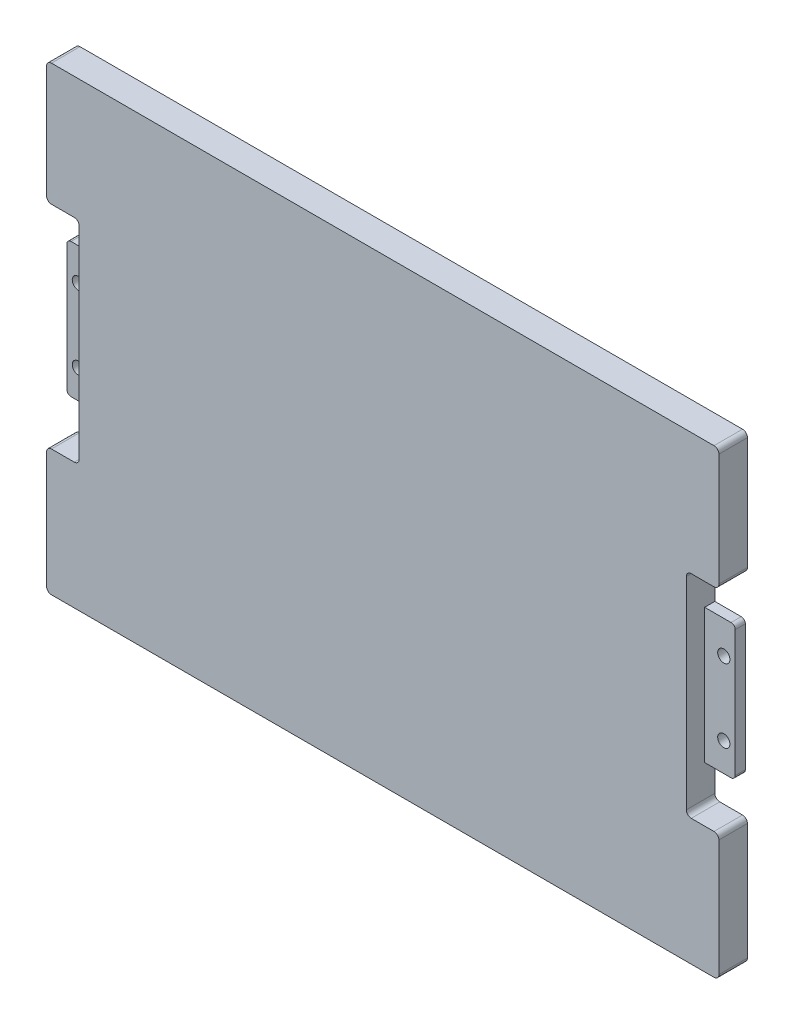
from build123d import *

# Parameters (mm, degrees)
EXTRUDE_1_DEPTH     = 7
SKETCH_2_R          = 6
CUT_EXTRUDE_1_DEPTH = 5.8
CUT_EXTRUDE_2_DEPTH = 0.2
FILLET_1_R          = 1
SKETCH_4_R          = 1.5
EXTRUDE_3_DEPTH     = 2.5
SKETCH_5_W          = 1.5
SKETCH_5_H          = 4.3
CUT_EXTRUDE_3_DEPTH = 2.5
SKETCH_6_W          = 3.174285876
SKETCH_6_H          = 3
CUT_EXTRUDE_4_DEPTH = 1


with BuildPart() as part:
    # Эскиз1 → Бобышка-Вытянуть1 (new body)
    with BuildSketch(Plane.XY):
        with BuildLine():
            Line((1.201755047, 83), (6.798244953, 83))
            ThreePointArc((6.798244953, 83), (7.648014096, 82.648014096), (8, 81.798244953))
            Line((8, 81.798244953), (8, 32.201755047))
            ThreePointArc((8, 32.201755047), (7.648014096, 31.351985904), (6.798244953, 31))
            Line((6.798244953, 31), (1.201755047, 31))
            ThreePointArc((1.201755047, 31), (0.351985904, 30.648014096), (0, 29.798244953))
            Line((0, 29.798244953), (0, 1.201755047))
            ThreePointArc((0, 1.201755047), (0.351985904, 0.351985904), (1.201755047, 0))
            Line((1.201755047, 0), (163.798244953, 0))
            ThreePointArc((163.798244953, 0), (164.648014096, 0.351985904), (165, 1.201755047))
            Line((165, 1.201755047), (165, 29.798244953))
            ThreePointArc((165, 29.798244953), (164.648014096, 30.648014096), (163.798244953, 31))
            Line((163.798244953, 31), (158.201755047, 31))
            ThreePointArc((158.201755047, 31), (157.351985904, 31.351985904), (157, 32.201755047))
            Line((157, 32.201755047), (157, 81.798244953))
            ThreePointArc((157, 81.798244953), (157.351985904, 82.648014096), (158.201755047, 83))
            Line((158.201755047, 83), (163.798244953, 83))
            ThreePointArc((163.798244953, 83), (164.648014096, 83.351985904), (165, 84.201755047))
            Line((165, 84.201755047), (165, 111.798244953))
            ThreePointArc((165, 111.798244953), (164.648014096, 112.648014096), (163.798244953, 113))
            Line((163.798244953, 113), (1.201755047, 113))
            ThreePointArc((1.201755047, 113), (0.351985904, 112.648014096), (0, 111.798244953))
            Line((0, 111.798244953), (0, 84.201755047))
            ThreePointArc((0, 84.201755047), (0.351985904, 83.351985904), (1.201755047, 83))
        make_face()
    extrude(amount=EXTRUDE_1_DEPTH)

    # Эскиз2 → Вырез-Вытянуть1 (cut)
    with BuildSketch(Plane(origin=(0, 0, 0), x_dir=(-1, 0, 0), z_dir=(0, 0, -1))):
        with BuildLine():
            Line((-161.798244953, 111), (-3.201755047, 111))
            ThreePointArc((-3.201755047, 111), (-2.351985904, 110.648014096), (-2, 109.798244953))
            Line((-2, 109.798244953), (-2, 86.201755047))
            ThreePointArc((-2, 86.201755047), (-2.351985904, 85.351985904), (-3.201755047, 85))
            Line((-3.201755047, 85), (-8.798244953, 85))
            ThreePointArc((-8.798244953, 85), (-9.648014096, 84.648014096), (-10, 83.798244953))
            Line((-10, 83.798244953), (-10, 30.201755047))
            ThreePointArc((-10, 30.201755047), (-9.648014096, 29.351985904), (-8.798244953, 29))
            Line((-8.798244953, 29), (-3.201755047, 29))
            ThreePointArc((-3.201755047, 29), (-2.351985904, 28.648014096), (-2, 27.798244953))
            Line((-2, 27.798244953), (-2, 3.201755047))
            ThreePointArc((-2, 3.201755047), (-2.351985904, 2.351985904), (-3.201755047, 2))
            Line((-3.201755047, 2), (-161.798244953, 2))
            ThreePointArc((-161.798244953, 2), (-162.648014096, 2.351985904), (-163, 3.201755047))
            Line((-163, 3.201755047), (-163, 27.798244953))
            ThreePointArc((-163, 27.798244953), (-162.648014096, 28.648014096), (-161.798244953, 29))
            Line((-161.798244953, 29), (-156.201755047, 29))
            ThreePointArc((-156.201755047, 29), (-155.351985904, 29.351985904), (-155, 30.201755047))
            Line((-155, 30.201755047), (-155, 70.5))
            Line((-155, 70.5), (-155, 74.8))
            Line((-155, 74.8), (-155, 83.798244953))
            ThreePointArc((-155, 83.798244953), (-155.351985904, 84.648014096), (-156.201755047, 85))
            Line((-156.201755047, 85), (-161.798244953, 85))
            ThreePointArc((-161.798244953, 85), (-162.648014096, 85.351985904), (-163, 86.201755047))
            Line((-163, 86.201755047), (-163, 109.798244953))
            ThreePointArc((-163, 109.798244953), (-162.648014096, 110.648014096), (-161.798244953, 111))
        make_face()
        with Locations((-82.5, 57)):
            Circle(SKETCH_2_R, mode=Mode.SUBTRACT)
    extrude(amount=-CUT_EXTRUDE_1_DEPTH, mode=Mode.SUBTRACT)

    # Эскиз3 → Вырез-Вытянуть2 (cut)
    # profile 1 of 2: a face of its own
    with BuildSketch(Plane(origin=(0, 0, 5.8), x_dir=(-1, 0, 0), z_dir=(0, 0, -1))):
        with BuildLine():
            Line((-120, 31), (-103, 31))
            ThreePointArc((-103, 31), (-102.292893219, 30.707106781), (-102, 30))
            Line((-102, 30), (-102, 19))
            ThreePointArc((-102, 19), (-102.292893219, 18.292893219), (-103, 18))
            Line((-103, 18), (-120, 18))
            ThreePointArc((-120, 18), (-120.707106781, 18.292893219), (-121, 19))
            Line((-121, 19), (-121, 30))
            ThreePointArc((-121, 30), (-120.707106781, 30.707106781), (-120, 31))
        make_face()
    # profile 2 of 2: a face of its own
    with BuildSketch(Plane(origin=(0, 0, 5.8), x_dir=(-1, 0, 0), z_dir=(0, 0, -1))):
        with BuildLine():
            Line((-52.1501229, 97.239252875), (-39.1501229, 97.239252875))
            ThreePointArc((-39.1501229, 97.239252875), (-38.443016119, 96.946359657), (-38.1501229, 96.239252875))
            Line((-38.1501229, 96.239252875), (-38.1501229, 83.239252875))
            ThreePointArc((-38.1501229, 83.239252875), (-38.443016119, 82.532146094), (-39.1501229, 82.239252875))
            Line((-39.1501229, 82.239252875), (-52.1501229, 82.239252875))
            ThreePointArc((-52.1501229, 82.239252875), (-52.857229681, 82.532146094), (-53.1501229, 83.239252875))
            Line((-53.1501229, 83.239252875), (-53.1501229, 96.239252875))
            ThreePointArc((-53.1501229, 96.239252875), (-52.857229681, 96.946359657), (-52.1501229, 97.239252875))
        make_face()
        Polygon((-41.403231286, 94.64375803), (-44.490035641, 94.64375803), (-48.784719961, 93.637191392), (-48.784719961, 92.630624755), (-44.490035641, 93.637191392), (-41.403231286, 93.637191392), align=None, mode=Mode.SUBTRACT)
        Polygon((-48.784719961, 91.774831443), (-44.490035641, 92.630624755), (-44.490035641, 91.774831443), (-48.784719961, 90.91903813), align=None, mode=Mode.SUBTRACT)
        Polygon((-48.784719961, 90.055112789), (-44.490035641, 90.910906102), (-44.490035641, 90.055112789), (-48.784719961, 89.067866896), align=None, mode=Mode.SUBTRACT)
        Polygon((-48.784719961, 88.216527408), (-44.490035641, 89.067866896), (-41.403231286, 89.067866896), (-41.403231286, 88.316883581), (-44.341167482, 88.316883581), (-48.784719961, 87.436033812), align=None, mode=Mode.SUBTRACT)
        Polygon((-48.609605566, 93.888102843), (-44.858812452, 94.806018458), (-44.858812452, 95.913847648), (-46.734209009, 95.170019477), (-48.609605566, 95.739760204), align=None, mode=Mode.SUBTRACT)
        Polygon((-48.609605566, 87.006809767), (-44.858812452, 87.715709289), (-44.858812452, 86.328076183), (-46.734209009, 86.674984459), (-48.609605566, 85.770006347), align=None, mode=Mode.SUBTRACT)
    extrude(amount=-CUT_EXTRUDE_2_DEPTH, mode=Mode.SUBTRACT)

    # Скругление1
    fillet_1_edges = [part.edges().sort_by_distance(p)[0] for p in [
        (155, 57, 5.8),
        (155.351985904, 29.351985904, 5.8),
        (159, 29, 5.8),
        (162.648014096, 28.648014096, 5.8),
        (163, 15.5, 5.8),
        (162.648014096, 2.351985904, 5.8),
        (82.5, 2, 5.8),
        (2.351985904, 2.351985904, 5.8),
        (2, 15.5, 5.8),
        (2.351985904, 28.648014096, 5.8),
        (6, 29, 5.8),
        (9.648014096, 29.351985904, 5.8),
        (10, 57, 5.8),
        (9.648014096, 84.648014096, 5.8),
        (6, 85, 5.8),
        (2.351985904, 85.351985904, 5.8),
        (2, 98, 5.8),
        (2.351985904, 110.648014096, 5.8),
        (155.351985904, 84.648014096, 5.8),
        (159, 85, 5.8),
        (162.648014096, 85.351985904, 5.8),
        (163, 98, 5.8),
        (162.648014096, 110.648014096, 5.8),
        (82.5, 111, 5.8),
    ]]
    fillet(fillet_1_edges, radius=FILLET_1_R)

    # Эскиз4 → Бобышка-Вытянуть3 (add)
    # profile 1 of 2: a face of its own
    with BuildSketch(Plane(origin=(0, 0, 0), x_dir=(-1, 0, 0), z_dir=(0, 0, -1))):
        with BuildLine():
            Line((-157, 73), (-163.5, 73))
            ThreePointArc((-163.5, 73), (-164.207106781, 72.707106781), (-164.5, 72))
            Line((-164.5, 72), (-164.5, 41))
            ThreePointArc((-164.5, 41), (-164.207106781, 40.292893219), (-163.5, 40))
            Line((-163.5, 40), (-157, 40))
            Line((-157, 40), (-157, 73))
        make_face()
        with Locations((-161.7, 47)):
            Circle(SKETCH_4_R, mode=Mode.SUBTRACT)
        with Locations((-161.7, 65)):
            Circle(SKETCH_4_R, mode=Mode.SUBTRACT)
    # profile 2 of 2: a face of its own
    with BuildSketch(Plane(origin=(0, 0, 0), x_dir=(-1, 0, 0), z_dir=(0, 0, -1))):
        with BuildLine():
            Line((-1.5, 73), (-8, 73))
            Line((-8, 73), (-8, 40))
            Line((-8, 40), (-1.5, 40))
            ThreePointArc((-1.5, 40), (-0.792893219, 40.292893219), (-0.5, 41))
            Line((-0.5, 41), (-0.5, 72))
            ThreePointArc((-0.5, 72), (-0.792893219, 72.707106781), (-1.5, 73))
        make_face()
        with Locations((-3.3, 47)):
            Circle(SKETCH_4_R, mode=Mode.SUBTRACT)
        with Locations((-3.3, 65)):
            Circle(SKETCH_4_R, mode=Mode.SUBTRACT)
    extrude(amount=-EXTRUDE_3_DEPTH)

    # Эскиз5 → Вырез-Вытянуть3 (cut)
    with BuildSketch(Plane(origin=(0, 0, 0), x_dir=(-1, 0, 0), z_dir=(0, 0, -1))):
        with Locations((-155.75, 72.65)):
            Rectangle(SKETCH_5_W, SKETCH_5_H)
    extrude(amount=-CUT_EXTRUDE_3_DEPTH, mode=Mode.SUBTRACT)

    # Эскиз6 → Вырез-Вытянуть4 (cut)
    with BuildSketch(Plane(origin=(0, 0, 0), x_dir=(-1, 0, 0), z_dir=(0, 0, -1))):
        with Locations((-156.587142938, 81.5)):
            Rectangle(SKETCH_6_W, SKETCH_6_H)
    extrude(amount=-CUT_EXTRUDE_4_DEPTH, mode=Mode.SUBTRACT)


solid = part.part
